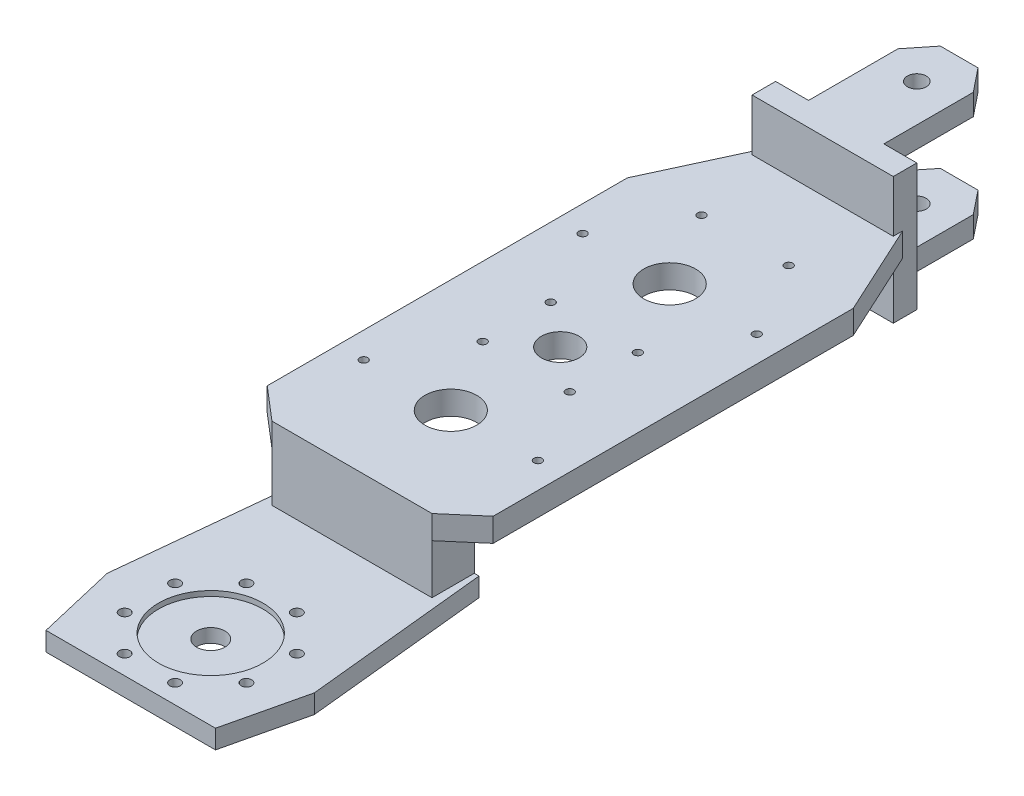
from build123d import *

# Parameters (mm, degrees)
SK_KNEE_PLATE_R         = 2.25
SK_KNEE_PLATE_R_2       = 6
KNEE_PLATE_DEPTH        = 8
SK_KNEE_PILOT_RECESS_R  = 22.15
KNEE_PILOT_RECESS_DEPTH = 2.2
SK_JOGGLE_W             = 68
SK_JOGGLE_H             = 39
JOGGLE_DEPTH            = 18
SK_WEB_R                = 1.7
SK_WEB_R_2              = 11
SK_WEB_R_3              = 8
WEB_DEPTH               = 10
SK_FORK_BAR_W           = 60
SK_FORK_BAR_H           = 54
FORK_BAR_DEPTH          = 10
SK_TINE_LAT_R           = 4
TINE_LAT_DEPTH          = 9
SK_TINE_MED_R           = 4
TINE_MED_DEPTH          = 9


with BuildPart() as part:
    # SK_Knee_Plate → Knee_Plate (new body)
    with BuildSketch(Plane(origin=(0, -34, 0), x_dir=(1, 0, 0), z_dir=(0, 1, 0))):
        Polygon((-36, -34), (36, -34), (44, 0), (36, 78), (-36, 78), (-44, 0), align=None)
        with Locations((25.86862691, 10.715136106)):
            Circle(SK_KNEE_PLATE_R, mode=Mode.SUBTRACT)
        with Locations((10.715136106, 25.86862691)):
            Circle(SK_KNEE_PLATE_R, mode=Mode.SUBTRACT)
        with Locations((-10.715136106, 25.86862691)):
            Circle(SK_KNEE_PLATE_R, mode=Mode.SUBTRACT)
        with Locations((-25.86862691, 10.715136106)):
            Circle(SK_KNEE_PLATE_R, mode=Mode.SUBTRACT)
        with Locations((-25.86862691, -10.715136106)):
            Circle(SK_KNEE_PLATE_R, mode=Mode.SUBTRACT)
        with Locations((-10.715136106, -25.86862691)):
            Circle(SK_KNEE_PLATE_R, mode=Mode.SUBTRACT)
        with Locations((10.715136106, -25.86862691)):
            Circle(SK_KNEE_PLATE_R, mode=Mode.SUBTRACT)
        with Locations((25.86862691, -10.715136106)):
            Circle(SK_KNEE_PLATE_R, mode=Mode.SUBTRACT)
        Circle(SK_KNEE_PLATE_R_2, mode=Mode.SUBTRACT)
    extrude(amount=KNEE_PLATE_DEPTH)

    # SK_Knee_Pilot_Recess → Knee_Pilot_Recess (cut)
    with BuildSketch(Plane(origin=(0, -26, 0), x_dir=(1, 0, 0), z_dir=(0, 1, 0))):
        Circle(SK_KNEE_PILOT_RECESS_R)
    extrude(amount=-KNEE_PILOT_RECESS_DEPTH, mode=Mode.SUBTRACT)

    # SK_Joggle → Joggle (add)
    with BuildSketch(Plane.XY.offset(-78)):
        with Locations((0, -14.5)):
            Rectangle(SK_JOGGLE_W, SK_JOGGLE_H)
    extrude(amount=JOGGLE_DEPTH)

    # SK_Web → Web (add)
    with BuildSketch(Plane(origin=(0, -5, 0), x_dir=(1, 0, 0), z_dir=(0, 1, 0))):
        Polygon((-34, 60), (34, 60), (48, 72), (48, 225), (30, 264), (-30, 264), (-48, 225), (-48, 72), align=None)
        with Locations((37, 102)):
            Circle(SK_WEB_R, mode=Mode.SUBTRACT)
        with Locations((18.5, 134.04293994)):
            Circle(SK_WEB_R, mode=Mode.SUBTRACT)
        with Locations((-18.5, 134.04293994)):
            Circle(SK_WEB_R, mode=Mode.SUBTRACT)
        with Locations((-37, 102)):
            Circle(SK_WEB_R, mode=Mode.SUBTRACT)
        with Locations((-18.5, 69.95706006)):
            Circle(SK_WEB_R, mode=Mode.SUBTRACT)
        with Locations((18.5, 69.95706006)):
            Circle(SK_WEB_R, mode=Mode.SUBTRACT)
        with Locations((37, 195)):
            Circle(SK_WEB_R, mode=Mode.SUBTRACT)
        with Locations((18.5, 227.04293994)):
            Circle(SK_WEB_R, mode=Mode.SUBTRACT)
        with Locations((-18.5, 227.04293994)):
            Circle(SK_WEB_R, mode=Mode.SUBTRACT)
        with Locations((-37, 195)):
            Circle(SK_WEB_R, mode=Mode.SUBTRACT)
        with Locations((-18.5, 162.95706006)):
            Circle(SK_WEB_R, mode=Mode.SUBTRACT)
        with Locations((18.5, 162.95706006)):
            Circle(SK_WEB_R, mode=Mode.SUBTRACT)
        with Locations((0, 102)):
            Circle(SK_WEB_R_2, mode=Mode.SUBTRACT)
        with Locations((0, 195)):
            Circle(SK_WEB_R_2, mode=Mode.SUBTRACT)
        with Locations((0, 148.5)):
            Circle(SK_WEB_R_3, mode=Mode.SUBTRACT)
    extrude(amount=WEB_DEPTH)

    # SK_Fork_Bar → Fork_Bar (add)
    with BuildSketch(Plane.XY.offset(-270)):
        Rectangle(SK_FORK_BAR_W, SK_FORK_BAR_H)
    extrude(amount=FORK_BAR_DEPTH)

    # SK_Tine_Lat → Tine_Lat (add)
    with BuildSketch(Plane(origin=(0, 18, 0), x_dir=(1, 0, 0), z_dir=(0, 1, 0))):
        Polygon((-16, 260), (16, 260), (16, 308), (8, 318), (-8, 318), (-16, 308), align=None)
        with Locations((0, 300)):
            Circle(SK_TINE_LAT_R, mode=Mode.SUBTRACT)
    extrude(amount=TINE_LAT_DEPTH)

    # SK_Tine_Med → Tine_Med (add)
    with BuildSketch(Plane(origin=(0, -27, 0), x_dir=(1, 0, 0), z_dir=(0, 1, 0))):
        Polygon((-16, 260), (16, 260), (16, 308), (8, 318), (-8, 318), (-16, 308), align=None)
        with Locations((0, 300)):
            Circle(SK_TINE_MED_R, mode=Mode.SUBTRACT)
    extrude(amount=TINE_MED_DEPTH)


solid = part.part
